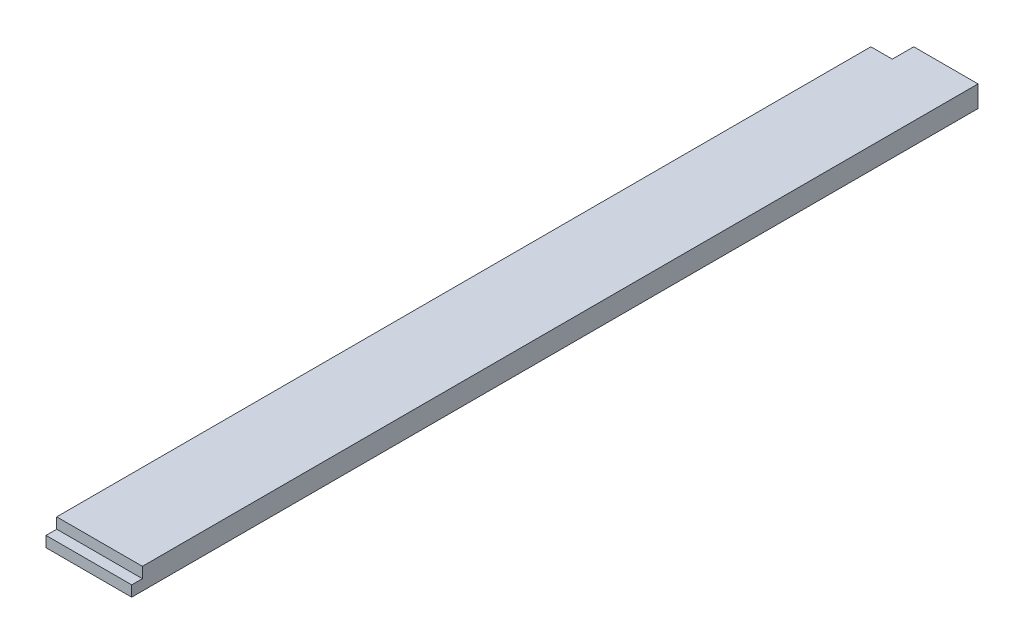
from build123d import *

# Parameters (mm, degrees)
BOSS_EXTRUDE1_DEPTH = 501.65
SKETCH2_W           = 50.8
SKETCH2_H           = 6.35
CUT_EXTRUDE1_DEPTH  = 6.35
SKETCH3_W           = 12.7
SKETCH3_H           = 12.7
CUT_EXTRUDE2_DEPTH  = 505.375507435


with BuildPart() as part:
    # Sketch1 → Boss-Extrude1 (new body)
    with BuildSketch(Plane.XY):
        Polygon((0, 12.7), (0, 6.35), (0, 0), (12.7, 0), (50.8, 0), (50.8, 12.7), align=None)
    extrude(amount=BOSS_EXTRUDE1_DEPTH)

    # Sketch2 → Cut-Extrude1 (cut)
    with BuildSketch(Plane.XZ.offset(-12.7)):
        with Locations((25.4, 498.475)):
            Rectangle(SKETCH2_W, SKETCH2_H)
    extrude(amount=CUT_EXTRUDE1_DEPTH, mode=Mode.SUBTRACT)

    # Sketch3 → Cut-Extrude2 (cut, through all)
    with BuildSketch(Plane(origin=(0, 12.7, 0), x_dir=(1, 0, 0), z_dir=(0, 1, 0))):
        with Locations((6.35, -6.35)):
            Rectangle(SKETCH3_W, SKETCH3_H)
    extrude(amount=-CUT_EXTRUDE2_DEPTH, mode=Mode.SUBTRACT)


solid = part.part
